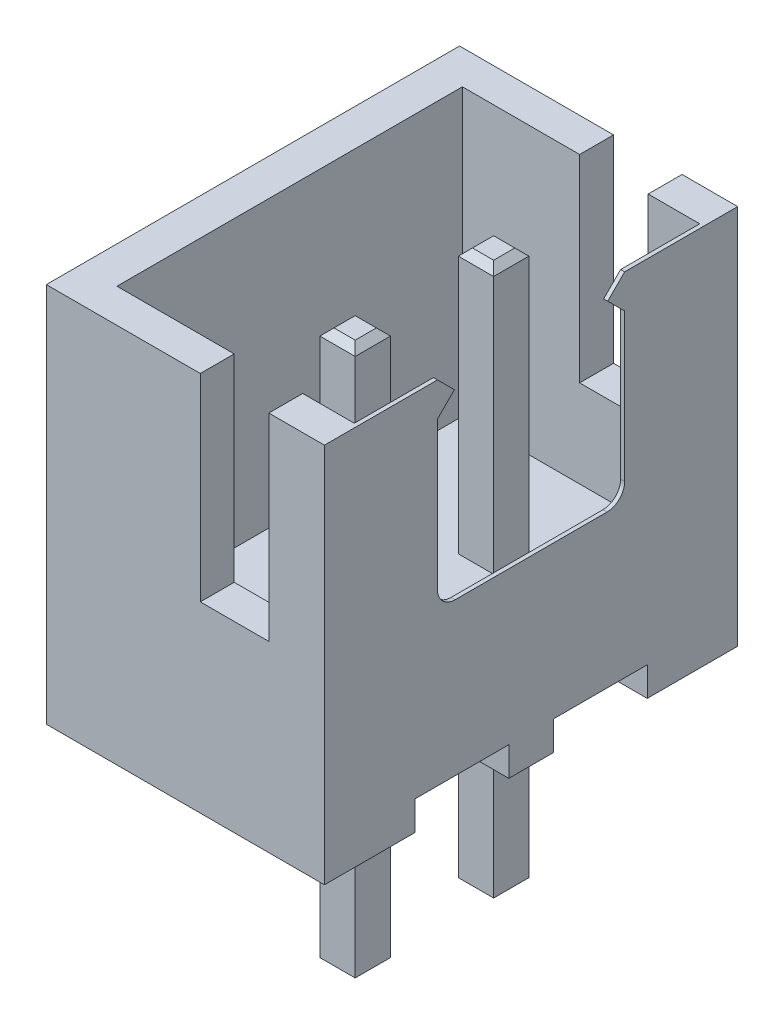
from build123d import *

# Parameters (mm, degrees)
SKETCH1_W           = 6.8453
SKETCH1_H           = 7.4295
BOSS_EXTRUDE1_DEPTH = 5
SKETCH2_W           = 5.8039
SKETCH2_H           = 0.127
CUT_EXTRUDE1_DEPTH  = 5.7277
CUT_EXTRUDE2_DEPTH  = 1.6891
CUT_EXTRUDE3_DEPTH  = 1.6891
SKETCH5_W           = 5
SKETCH5_H           = 4.1148
BOSS_EXTRUDE2_DEPTH = 0.127
SKETCH6_W           = 3.3147
SKETCH6_H           = 0.127
CUT_EXTRUDE4_DEPTH  = 12.271894355
CUT_EXTRUDE5_DEPTH  = 1.6891
CUT_EXTRUDE6_DEPTH  = 1.6891
SKETCH9_W           = 5
SKETCH9_H           = 1.6256
BOSS_EXTRUDE3_DEPTH = 0.127
SKETCH10_W          = 4.2672
SKETCH10_H          = 6.2103
CUT_EXTRUDE7_DEPTH  = 5.1308
CUT_EXTRUDE8_DEPTH  = 12.239966375
SKETCH12_W          = 1.2319
SKETCH12_H          = 3.556
CUT_EXTRUDE9_DEPTH  = 12.232796419
SKETCH13_W          = 1.2319
SKETCH13_H          = 3.556
CUT_EXTRUDE10_DEPTH = 12.613016388
SKETCH14_W          = 0.635
SKETCH14_H          = 0.635
BOSS_EXTRUDE4_DEPTH = 3.5814
SKETCH15_W          = 0.635
SKETCH15_H          = 0.635
BOSS_EXTRUDE5_DEPTH = 3.5814
SKETCH16_W          = 0.635
SKETCH16_H          = 0.635
BOSS_EXTRUDE6_DEPTH = 4.7625
SKETCH17_W          = 0.635
SKETCH17_H          = 0.635
BOSS_EXTRUDE7_DEPTH = 4.7625
DRAFT1_ANGLE        = 45
DRAFT2_ANGLE        = 45
CHAMFER1_SIZE       = 0.127
FILLET1_R           = 0.3175


with BuildPart() as part:
    # Sketch1 → Boss-Extrude1 (new body)
    with BuildSketch(Plane(origin=(-5.7277, 0, 0), x_dir=(0, -1, 0), z_dir=(-1, 0, 0))):
        with Locations((-3.42265, -3.71475)):
            Rectangle(SKETCH1_W, SKETCH1_H)
    extrude(amount=-BOSS_EXTRUDE1_DEPTH)

    # Sketch2 → Cut-Extrude1 (cut)
    with BuildSketch(Plane.ZY.offset(5.7277)):
        with Locations((-4.52755, 0.0635)):
            Rectangle(SKETCH2_W, SKETCH2_H)
    extrude(amount=-CUT_EXTRUDE1_DEPTH, mode=Mode.SUBTRACT)

    # Sketch3 → Cut-Extrude2 (cut)
    with BuildSketch(Plane.XY.offset(-1.6256)):
        Polygon((-5.7277, 0.127), (-3.3477, 0.127), (-5.7277, 0.762), align=None)
    extrude(amount=-CUT_EXTRUDE2_DEPTH, mode=Mode.SUBTRACT)

    # Sketch4 → Cut-Extrude3 (cut)
    with BuildSketch(Plane.XY.offset(-1.6256)):
        Polygon((-1.94, 0.127), (0, 0.127), (0, 0.762), align=None)
    extrude(amount=-CUT_EXTRUDE3_DEPTH, mode=Mode.SUBTRACT)

    # Sketch5 → Boss-Extrude2 (add)
    with BuildSketch(Plane.XZ.offset(-0.127)):
        with Locations((-3.2277, -5.3721)):
            Rectangle(SKETCH5_W, SKETCH5_H)
    extrude(amount=BOSS_EXTRUDE2_DEPTH)

    # Sketch6 → Cut-Extrude4 (cut, through all)
    with BuildSketch(Plane.ZY.offset(5.7277)):
        with Locations((-5.77215, 0.0635)):
            Rectangle(SKETCH6_W, SKETCH6_H)
    extrude(amount=-CUT_EXTRUDE4_DEPTH, mode=Mode.SUBTRACT)

    # Sketch7 → Cut-Extrude5 (cut)
    with BuildSketch(Plane.XY.offset(-4.1148)):
        Polygon((-5.7277, 0.127), (-3.3477, 0.127), (-5.7277, 0.762), align=None)
    extrude(amount=-CUT_EXTRUDE5_DEPTH, mode=Mode.SUBTRACT)

    # Sketch8 → Cut-Extrude6 (cut)
    with BuildSketch(Plane.XY.offset(-4.1148)):
        Polygon((-1.94, 0.127), (0, 0.127), (0, 0.762), align=None)
    extrude(amount=-CUT_EXTRUDE6_DEPTH, mode=Mode.SUBTRACT)

    # Sketch9 → Boss-Extrude3 (add)
    with BuildSketch(Plane.XZ.offset(-0.127)):
        with Locations((-3.2277, -6.6167)):
            Rectangle(SKETCH9_W, SKETCH9_H)
    extrude(amount=BOSS_EXTRUDE3_DEPTH)

    # Sketch10 → Cut-Extrude7 (cut)
    with BuildSketch(Plane(origin=(0, 6.8453, 0), x_dir=(-1, 0, 0), z_dir=(0, 1, 0))):
        with Locations((2.9337, -3.71475)):
            Rectangle(SKETCH10_W, SKETCH10_H)
    extrude(amount=-CUT_EXTRUDE7_DEPTH, mode=Mode.SUBTRACT)

    # Sketch11 → Cut-Extrude8 (cut, through all)
    with BuildSketch(Plane.ZY.offset(0.8001)):
        Polygon((-2.032, 6.8453), (-5.3975, 6.8453), (-4.7879, 6.2357), (-5.3975, 6.2357), (-5.3975, 3.2639), (-2.032, 3.2639), (-2.032, 6.2357), (-2.6416, 6.2357), align=None)
    extrude(amount=-CUT_EXTRUDE8_DEPTH, mode=Mode.SUBTRACT)

    # Sketch12 → Cut-Extrude9 (cut, through all)
    with BuildSketch(Plane(origin=(0, 0, -0.6096), x_dir=(-1, 0, 0), z_dir=(0, 0, -1))):
        with Locations((2.34365, 5.0673)):
            Rectangle(SKETCH12_W, SKETCH12_H)
    extrude(amount=-CUT_EXTRUDE9_DEPTH, mode=Mode.SUBTRACT)

    # Sketch13 → Cut-Extrude10 (cut, through all)
    with BuildSketch(Plane(origin=(0, 0, -7.4295), x_dir=(-1, 0, 0), z_dir=(0, 0, -1))):
        with Locations((2.34365, 5.0673)):
            Rectangle(SKETCH13_W, SKETCH13_H)
    extrude(amount=-CUT_EXTRUDE10_DEPTH, mode=Mode.SUBTRACT)

    # Sketch14 → Boss-Extrude4 (add)
    with BuildSketch(Plane.XZ.offset(-0.127)):
        with Locations((-2.6452, -4.95935)):
            Rectangle(SKETCH14_W, SKETCH14_H)
    extrude(amount=BOSS_EXTRUDE4_DEPTH)

    # Sketch15 → Boss-Extrude5 (add)
    with BuildSketch(Plane.XZ.offset(-0.127)):
        with Locations((-2.6452, -2.47015)):
            Rectangle(SKETCH15_W, SKETCH15_H)
    extrude(amount=BOSS_EXTRUDE5_DEPTH)

    # Sketch16 → Boss-Extrude6 (add)
    with BuildSketch(Plane(origin=(0, 1.7145, 0), x_dir=(-1, 0, 0), z_dir=(0, 1, 0))):
        with Locations((2.6452, -4.95935)):
            Rectangle(SKETCH16_W, SKETCH16_H)
    extrude(amount=BOSS_EXTRUDE6_DEPTH)

    # Sketch17 → Boss-Extrude7 (add)
    with BuildSketch(Plane(origin=(0, 1.7145, 0), x_dir=(-1, 0, 0), z_dir=(0, 1, 0))):
        with Locations((2.6452, -2.47015)):
            Rectangle(SKETCH17_W, SKETCH17_H)
    extrude(amount=BOSS_EXTRUDE7_DEPTH)

    # Draft1
    draft1_faces = [part.faces().sort_by_distance(p)[0] for p in [
        (-0.7639, 6.2357, -2.3368),
    ]]
    draft(draft1_faces, Plane(origin=(-0.7277, 3.2639, -2.032), x_dir=(-1, 0, 0), z_dir=(0, 0, -1)), DRAFT1_ANGLE)

    # Draft2
    draft2_faces = [part.faces().sort_by_distance(p)[0] for p in [
        (-0.7639, 6.2357, -5.0927),
    ]]
    draft(draft2_faces, Plane(origin=(-0.7277, 6.2357, -5.3975), x_dir=(1, 0, 0), z_dir=(0, 0, 1)), DRAFT2_ANGLE)

    # Chamfer1
    chamfer1_edges = [part.edges().sort_by_distance(p)[0] for p in [
        (-2.9627, -3.4544, -4.95935),
        (-2.6452, -3.4544, -4.64185),
        (-2.6452, -3.4544, -5.27685),
        (-2.3277, -3.4544, -4.95935),
        (-2.9627, 6.477, -2.47015),
        (-2.6452, 6.477, -2.78765),
        (-2.6452, 6.477, -2.15265),
        (-2.3277, 6.477, -2.47015),
        (-2.6452, 6.477, -5.27685),
        (-2.9627, 6.477, -4.95935),
        (-2.3277, 6.477, -4.95935),
        (-2.6452, 6.477, -4.64185),
        (-2.3277, -3.4544, -2.47015),
        (-2.6452, -3.4544, -2.78765),
        (-2.6452, -3.4544, -2.15265),
        (-2.9627, -3.4544, -2.47015),
    ]]
    chamfer(chamfer1_edges, length=CHAMFER1_SIZE)

    # Fillet1
    fillet1_edges = [part.edges().sort_by_distance(p)[0] for p in [
        (-0.7639, 3.2639, -2.032),
        (-0.7639, 3.2639, -5.3975),
    ]]
    fillet(fillet1_edges, radius=FILLET1_R)


solid = part.part
